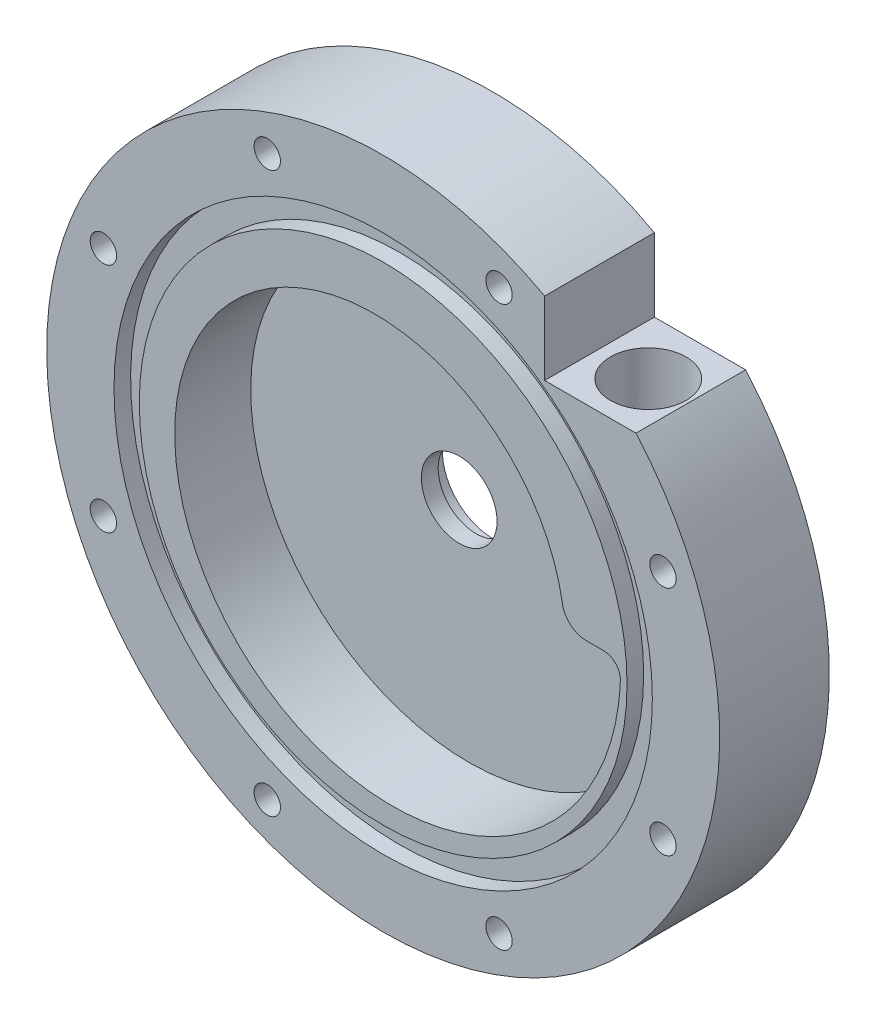
from build123d import *

# Parameters (mm, degrees)
VOLUTE_CUT_DEPTH                  = 91.942021096
CAP_CUT_DEPTH                     = 92.035204776
SKETCH28_W                        = 17.225365526
SKETCH28_H                        = 13.796548987
OUTLET_HOLE_CUT_DEPTH             = 93.157644427
PIPE_TAP_DRILL_FOR_3_8_TAP1_D     = 14.2748
PIPE_TAP_DRILL_FOR_3_8_TAP1_DEPTH = 12.7
PIPE_TAP_DRILL_FOR_3_8_TAP1_TIP   = 4.288582582
SKETCH26_R                        = 2.4892
FASTENER_HOLE_DEPTH               = 93.157644427
FASTENER_HOLES_COUNT              = 8
SKETCH16_R                        = 50.8
SKETCH16_R_2                      = 46.0248
O_RING_GROOVE_DEPTH               = 3.1369


with BuildPart() as part:
    # Sketch22 → Main Body (revolve)
    with BuildSketch(Plane(origin=(0, 0, 0), x_dir=(1, 0, 0), z_dir=(0, 1, 0))):
        Polygon((-25.4, 0), (-7.14375, 0), (-7.14375, 3.175), (-9.525, 3.175), (-9.525, 6.35), (-63.5, 6.35), (-63.5, -14.351), (-25.4, -14.351), align=None)
    revolve(axis=Axis((0, 0, 0), (0, 0, -1)))

    # Sketch23 → Volute Cut (cut, through all)
    with BuildSketch(Plane.XY):
        with BuildLine():
            Line((38.338438787, 3.304670655), (41.593494633, 3.304670655))
            ThreePointArc((41.593494633, 3.304670655), (43.883034366, 2.328238698), (44.763213962, 0))
            add(Edge.make_bspline(
                [(34.261847842, 0), (34.264784524, 0.071844985), (34.270658697, 0.215554733), (34.277793881, 0.431212342), (34.283685604, 0.646965689), (34.292740629, 1.07883436), (34.298205408, 2.088188166), (34.244713267, 3.603653756), (34.084824015, 5.4046479), (33.844223642, 7.127751114), (33.51671457, 8.840379872), (33.102704602, 10.538150267), (32.602833338, 12.216692386), (32.017965922, 13.871662747), (31.349191468, 15.498755899), (30.5978199, 17.093716034), (29.765379241, 18.652348338), (28.85361226, 20.170530201), (27.864472781, 21.644222235), (26.800121479, 23.069479109), (25.662921186, 24.442460162), (24.455431695, 25.759439779), (23.180404062, 27.016817518), (21.840774402, 28.21112794), (20.439657201, 29.339050137), (18.980338149, 30.397416931), (17.466266506, 31.383223709), (15.90104702, 32.293636882), (14.288431416, 33.126001944), (12.632309463, 33.877851098), (10.936699661, 34.546910451), (9.205739549, 35.131106723), (7.443675663, 35.628573491), (5.654853178, 36.037656917), (3.84370524, 36.356920959), (2.014742036, 36.585152051), (0.172539606, 36.721363228), (-1.678271559, 36.764797689), (-3.533018111, 36.714931787), (-5.3869956, 36.571477434), (-7.235480366, 36.334383913), (-9.07374153, 36.003839086), (-10.897053062, 35.58027), (-12.700705888, 35.064342878), (-14.480020006, 34.456962497), (-16.230356593, 33.759270957), (-17.947130045, 32.972645827), (-19.625819949, 32.098697681), (-21.261982935, 31.139267032), (-22.851264382, 30.096420656), (-24.389409957, 28.972447316), (-25.872276938, 27.769852906), (-27.29584531, 26.491355013), (-28.656228591, 25.139876909), (-29.949684369, 23.718540989), (-31.17262451, 22.230661674), (-32.32162502, 20.679737787), (-33.393435533, 19.069444419), (-34.384988385, 17.40362431), (-35.293407272, 15.686278765), (-36.11601545, 13.921558115), (-36.850343459, 12.113751764), (-37.494136352, 10.267277823), (-38.045360401, 8.38667238), (-38.502209273, 6.476578416), (-38.863109645, 4.541734393), (-39.126726243, 2.586962555), (-39.291966303, 0.617156959), (-39.357983419, -1.362728731), (-39.324180782, -3.347693652), (-39.190213789, -5.332702333), (-38.955992027, -7.312697422), (-38.621680597, -9.282612528), (-38.187700803, -11.23738514), (-37.654730183, -13.171969596), (-37.023701879, -15.081350059), (-36.295803353, -16.960553479), (-35.472474446, -18.804662496), (-34.555404779, -20.608828259), (-33.546530503, -22.368283123), (-32.448030404, -24.078353194), (-31.26232137, -25.734470685), (-29.992053224, -27.332186055), (-28.640102943, -28.867179894), (-27.209568266, -30.335274533), (-25.70376071, -31.732445327), (-24.12619801, -33.054831606), (-22.480595995, -34.298747245), (-20.770859922, -35.460690836), (-19.001075294, -36.537355425), (-17.175498164, -37.525637795), (-15.298544973, -38.422647266), (-13.374781932, -39.225713982), (-11.408913967, -39.93239668), (-9.405773269, -40.540489886), (-7.370307471, -41.048030557), (-5.307567475, -41.453304115), (-3.222694963, -41.754849874), (-1.120909625, -41.951465843), (0.992503863, -42.042212881), (3.11220909, -42.026418195), (5.232831344, -41.903678173), (7.348971199, -41.673860539), (9.455218223, -41.337105816), (11.546164776, -40.893828104), (13.616419848, -40.344715153), (15.660622923, -39.690727741), (17.673457812, -38.93309834), (19.649666438, -38.073329092), (21.584062524, -37.113189077), (23.471545152, -36.054710891), (25.307112165, -34.900186527), (27.085873367, -33.652162581), (28.803063488, -32.313434789), (30.454054887, -30.887041888), (32.034369952, -29.376258848), (33.539693165, -27.784589454), (34.9658828, -26.115758288), (36.30898223, -24.373702093), (37.565230795, -22.562560578), (38.731074224, -20.686666652), (39.803174556, -18.750536124), (40.778419563, -16.758856904), (41.653931621, -14.716477704), (42.427076016, -12.628396291), (43.09546867, -10.499747309), (43.656983249, -8.335789696), (44.109757635, -6.141893742), (44.437890089, -4.016226935), (44.606204477, -2.433517734), (44.678884826, -1.499236103), (44.704449619, -1.124895611), (44.721871029, -0.843919777), (44.737493089, -0.562768038), (44.751475519, -0.281457909), (44.759300821, -0.093827142), (44.763213962, 0)],
                knots=[0, 0, 0, 0, 0.0008712, 0.001742639, 0.002614317, 0.003486233, 0.006976282, 0.014842882, 0.021851749, 0.028876067, 0.0359159, 0.042971309, 0.050042349, 0.057129073, 0.064231529, 0.071349764, 0.078483823, 0.085633747, 0.092799578, 0.099981356, 0.107179117, 0.1143929, 0.121622741, 0.128868673, 0.136130732, 0.14340895, 0.15070336, 0.158013994, 0.165340883, 0.172684057, 0.180043546, 0.18741938, 0.194811587, 0.202220196, 0.209645235, 0.217086731, 0.224544712, 0.232019203, 0.239510231, 0.247017823, 0.254542004, 0.262082798, 0.269640231, 0.277214328, 0.284805113, 0.29241261, 0.300036843, 0.307677836, 0.31533561, 0.323010191, 0.3307016, 0.338409861, 0.346134995, 0.353877025, 0.361635972, 0.369411859, 0.377204707, 0.385014537, 0.392841372, 0.40068523, 0.408546135, 0.416424105, 0.424319163, 0.432231327, 0.440160619, 0.448107058, 0.456070665, 0.464051459, 0.47204946, 0.480064687, 0.48809716, 0.496146898, 0.50421392, 0.512298245, 0.520399892, 0.52851888, 0.536655227, 0.544808952, 0.552980073, 0.561168609, 0.569374578, 0.577597998, 0.585838887, 0.594097262, 0.602373142, 0.610666545, 0.618977488, 0.627305988, 0.635652063, 0.64401573, 0.652397007, 0.66079591, 0.669212457, 0.677646665, 0.686098551, 0.694568131, 0.703055422, 0.711560441, 0.720083205, 0.728623729, 0.737182031, 0.745758127, 0.754352033, 0.762963766, 0.771593341, 0.780240774, 0.788906083, 0.797589282, 0.806290387, 0.815009415, 0.823746381, 0.8325013, 0.841274189, 0.850065063, 0.858873938, 0.867700829, 0.876545751, 0.885408719, 0.89428975, 0.903188858, 0.912106059, 0.921041367, 0.929994798, 0.938966366, 0.947956087, 0.956963975, 0.965990046, 0.975034314, 0.984096794, 0.992041415, 0.994313871, 0.995450526, 0.996587467, 0.997724693, 0.998862204, 1, 1, 1, 1], degree=3))
            ThreePointArc((34.261847842, 0), (34.713967842, -0.470978061), (35.166087842, 0))
            ThreePointArc((35.166087842, 0), (36.047988032, 2.32841128), (38.338438787, 3.304670655))
        make_face()
    extrude(amount=VOLUTE_CUT_DEPTH, mode=Mode.SUBTRACT)

    # Sketch25 → Cap Cut (cut, through all)
    with BuildSketch(Plane.XY.offset(8.58012)):
        with BuildLine():
            Line((41.593494633, 3.304670655), (38.338438787, 3.304670655))
            ThreePointArc((38.338438787, 3.304670655), (35.382102361, 4.389545114), (33.829218893, 7.129149209))
            add(Edge.make_bspline(
                [(33.829218893, 7.129149209), (33.734655008, 7.700712878), (33.516311109, 8.842034383), (33.102704602, 10.538150267), (32.602833338, 12.216692386), (32.017965922, 13.871662747), (31.349191468, 15.498755899), (30.5978199, 17.093716034), (29.765379241, 18.652348338), (28.85361226, 20.170530201), (27.864472781, 21.644222235), (26.800121479, 23.069479109), (25.662921186, 24.442460162), (24.455431695, 25.759439779), (23.180404062, 27.016817518), (21.840774402, 28.21112794), (20.439657201, 29.339050137), (18.980338149, 30.397416931), (17.466266506, 31.383223709), (15.90104702, 32.293636882), (14.288431416, 33.126001944), (12.632309463, 33.877851098), (10.936699661, 34.546910451), (9.205739549, 35.131106723), (7.443675663, 35.628573491), (5.654853178, 36.037656917), (3.84370524, 36.356920959), (2.014742036, 36.585152051), (0.172539606, 36.721363228), (-1.678271559, 36.764797689), (-3.533018111, 36.714931787), (-5.3869956, 36.571477434), (-7.235480366, 36.334383913), (-9.07374153, 36.003839086), (-10.897053062, 35.58027), (-12.700705888, 35.064342878), (-14.480020006, 34.456962497), (-16.230356593, 33.759270957), (-17.947130045, 32.972645827), (-19.625819949, 32.098697681), (-21.261982935, 31.139267032), (-22.851264382, 30.096420656), (-24.389409957, 28.972447316), (-25.872276938, 27.769852906), (-27.29584531, 26.491355013), (-28.656228591, 25.139876909), (-29.949684369, 23.718540989), (-31.17262451, 22.230661674), (-32.32162502, 20.679737787), (-33.393435533, 19.069444419), (-34.384988385, 17.40362431), (-35.293407272, 15.686278765), (-36.11601545, 13.921558115), (-36.850343459, 12.113751764), (-37.494136352, 10.267277823), (-38.045360401, 8.38667238), (-38.502209273, 6.476578416), (-38.863109645, 4.541734393), (-39.126726243, 2.586962555), (-39.291966303, 0.617156959), (-39.357983419, -1.362728731), (-39.324180782, -3.347693652), (-39.190213789, -5.332702333), (-38.955992027, -7.312697422), (-38.621680597, -9.282612528), (-38.187700803, -11.23738514), (-37.654730183, -13.171969596), (-37.023701879, -15.081350059), (-36.295803353, -16.960553479), (-35.472474446, -18.804662496), (-34.555404779, -20.608828259), (-33.546530503, -22.368283123), (-32.448030404, -24.078353194), (-31.26232137, -25.734470685), (-29.992053224, -27.332186055), (-28.640102943, -28.867179894), (-27.209568266, -30.335274533), (-25.70376071, -31.732445327), (-24.12619801, -33.054831606), (-22.480595995, -34.298747245), (-20.770859922, -35.460690836), (-19.001075294, -36.537355425), (-17.175498164, -37.525637795), (-15.298544973, -38.422647266), (-13.374781932, -39.225713982), (-11.408913967, -39.93239668), (-9.405773269, -40.540489886), (-7.370307471, -41.048030557), (-5.307567475, -41.453304115), (-3.222694963, -41.754849874), (-1.120909625, -41.951465843), (0.992503863, -42.042212881), (3.11220909, -42.026418195), (5.232831344, -41.903678173), (7.348971199, -41.673860539), (9.455218223, -41.337105816), (11.546164776, -40.893828104), (13.616419848, -40.344715153), (15.660622923, -39.690727741), (17.673457812, -38.93309834), (19.649666438, -38.073329092), (21.584062524, -37.113189077), (23.471545152, -36.054710891), (25.307112165, -34.900186527), (27.085873367, -33.652162581), (28.803063488, -32.313434789), (30.454054887, -30.887041888), (32.034369952, -29.376258848), (33.539693165, -27.784589454), (34.9658828, -26.115758288), (36.30898223, -24.373702093), (37.565230795, -22.562560578), (38.731074224, -20.686666652), (39.803174556, -18.750536124), (40.778419563, -16.758856904), (41.653931621, -14.716477704), (42.427076016, -12.628396291), (43.09546867, -10.499747309), (43.656983249, -8.335789696), (44.109757635, -6.141893742), (44.437890089, -4.016226935), (44.606204477, -2.433517734), (44.678884826, -1.499236103), (44.704449619, -1.124895611), (44.721871029, -0.843919777), (44.737493089, -0.562768038), (44.751475519, -0.281457909), (44.759300821, -0.093827142), (44.763213962, 0)],
                knots=[0.028896694, 0.028896694, 0.028896694, 0.028896694, 0.0359159, 0.042971309, 0.050042349, 0.057129073, 0.064231529, 0.071349764, 0.078483823, 0.085633747, 0.092799578, 0.099981356, 0.107179117, 0.1143929, 0.121622741, 0.128868673, 0.136130732, 0.14340895, 0.15070336, 0.158013994, 0.165340883, 0.172684057, 0.180043546, 0.18741938, 0.194811587, 0.202220196, 0.209645235, 0.217086731, 0.224544712, 0.232019203, 0.239510231, 0.247017823, 0.254542004, 0.262082798, 0.269640231, 0.277214328, 0.284805113, 0.29241261, 0.300036843, 0.307677836, 0.31533561, 0.323010191, 0.3307016, 0.338409861, 0.346134995, 0.353877025, 0.361635972, 0.369411859, 0.377204707, 0.385014537, 0.392841372, 0.40068523, 0.408546135, 0.416424105, 0.424319163, 0.432231327, 0.440160619, 0.448107058, 0.456070665, 0.464051459, 0.47204946, 0.480064687, 0.48809716, 0.496146898, 0.50421392, 0.512298245, 0.520399892, 0.52851888, 0.536655227, 0.544808952, 0.552980073, 0.561168609, 0.569374578, 0.577597998, 0.585838887, 0.594097262, 0.602373142, 0.610666545, 0.618977488, 0.627305988, 0.635652063, 0.64401573, 0.652397007, 0.66079591, 0.669212457, 0.677646665, 0.686098551, 0.694568131, 0.703055422, 0.711560441, 0.720083205, 0.728623729, 0.737182031, 0.745758127, 0.754352033, 0.762963766, 0.771593341, 0.780240774, 0.788906083, 0.797589282, 0.806290387, 0.815009415, 0.823746381, 0.8325013, 0.841274189, 0.850065063, 0.858873938, 0.867700829, 0.876545751, 0.885408719, 0.89428975, 0.903188858, 0.912106059, 0.921041367, 0.929994798, 0.938966366, 0.947956087, 0.956963975, 0.965990046, 0.975034314, 0.984096794, 0.992041415, 0.994313871, 0.995450526, 0.996587467, 0.997724693, 0.998862204, 1, 1, 1, 1], degree=3))
            ThreePointArc((44.763213962, 0), (43.883034366, 2.328238698), (41.593494633, 3.304670655))
        make_face()
    extrude(amount=CAP_CUT_DEPTH, mode=Mode.SUBTRACT)

    # Sketch28 → Outlet Hole Cut (cut, through all)
    with BuildSketch(Plane.XY.offset(14.351)):
        with Locations((39.092682763, 48.808274494)):
            Rectangle(SKETCH28_W, SKETCH28_H)
    extrude(amount=-OUTLET_HOLE_CUT_DEPTH, mode=Mode.SUBTRACT)

    # Sketch20 → Outlet Hole (revolve, cut)
    with BuildSketch(Plane(origin=(39.96596671, 41.91, 4.29006), x_dir=(0, 0, 1), z_dir=(1, 0, 0))):
        Polygon((0, 0), (0, 53.661598698), (4.7625, 50.8), (4.7625, 0), align=None)
    revolve(axis=Axis((39.96596671, 48.26, 4.29006), (0, -1, 0)), mode=Mode.SUBTRACT)

    # Pipe Tap Drill for 3/8 Tap1
    with Locations(Plane(origin=(39.96596671, 41.91, 4.29006), x_dir=(0, 0, 1), z_dir=(0, 1, 0))):
        with Locations((0, 0)):
            Hole(PIPE_TAP_DRILL_FOR_3_8_TAP1_D / 2, depth=PIPE_TAP_DRILL_FOR_3_8_TAP1_DEPTH)
            with Locations((0, 0, -(PIPE_TAP_DRILL_FOR_3_8_TAP1_DEPTH + PIPE_TAP_DRILL_FOR_3_8_TAP1_TIP / 2))):  # 118° drill point
                Cone(0, PIPE_TAP_DRILL_FOR_3_8_TAP1_D / 2, PIPE_TAP_DRILL_FOR_3_8_TAP1_TIP, mode=Mode.SUBTRACT)

    # Sketch26 → Fastener Hole (cut, through all)
    with BuildSketch(Plane.XY.offset(14.351)):
        with Locations((52.799715283, -21.87035816)):
            Circle(SKETCH26_R)
    fastener_hole = extrude(amount=-FASTENER_HOLE_DEPTH, mode=Mode.SUBTRACT)

    # Fastener Holes: Fastener Hole ×8 about axis
    fastener_holes_axis = Axis((0, 0, 0), (0, 0, 1))
    for i in range(1, FASTENER_HOLES_COUNT):
        add(fastener_hole.rotate(fastener_holes_axis, i * 360 / FASTENER_HOLES_COUNT), mode=Mode.SUBTRACT)

    # Sketch16 → O-Ring Groove (cut)
    with BuildSketch(Plane.XY.offset(14.351)):
        Circle(SKETCH16_R)
        Circle(SKETCH16_R_2, mode=Mode.SUBTRACT)
    extrude(amount=-O_RING_GROOVE_DEPTH, mode=Mode.SUBTRACT)


solid = part.part
